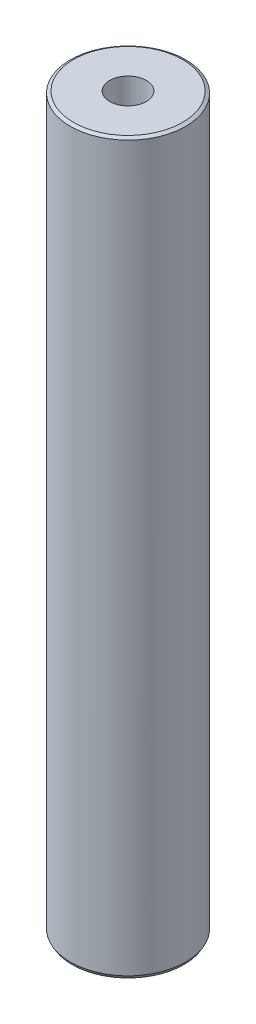
from build123d import *
from OCP.BRepFilletAPI import BRepFilletAPI_MakeChamfer

# Parameters (mm, degrees)
SKETCH1_R           = 47.5
BOSS_EXTRUDE1_DEPTH = 600
SKETCH2_R           = 15.071937105
CUT_EXTRUDE1_DEPTH  = 604.748706003
CHAMFER1_SIZE       = 1.500488561
CHAMFER1_SIZE2      = 2.598922424


with BuildPart() as part:
    # Sketch1 → Boss-Extrude1 (new body)
    with BuildSketch(Plane(origin=(0, 0, 0), x_dir=(1, 0, 0), z_dir=(0, 1, 0))):
        Circle(SKETCH1_R)
    extrude(amount=BOSS_EXTRUDE1_DEPTH)

    # Sketch2 → Cut-Extrude1 (cut, through all)
    with BuildSketch(Plane(origin=(0, 0, 0), x_dir=(1, 0, 0), z_dir=(0, 1, 0))):
        Circle(SKETCH2_R)
    extrude(amount=CUT_EXTRUDE1_DEPTH, mode=Mode.SUBTRACT)

    # Chamfer1: one chamfer whose edges measure the first distance from different faces: ONE call of the kernel's chamfer builder (chamfer() names one face for all edges)
    chamfer1_edges_1 = [part.edges().sort_by_distance(p)[0] for p in [
        (-47.5, 600, 0),
    ]]
    chamfer1_side_1 = [part.faces().sort_by_distance(p)[0] for p in [
        (-47.5, 300, 0),
    ]]
    chamfer1_edges_2 = [part.edges().sort_by_distance(p)[0] for p in [
        (-47.5, 0, 0),
    ]]
    chamfer1_side_2 = [part.faces().sort_by_distance(p)[0] for p in [
        (-46.156497116, 0, 0),
    ]]
    chamfer1 = BRepFilletAPI_MakeChamfer(part.part.solid().wrapped)
    for e in chamfer1_edges_1:
        chamfer1.Add(CHAMFER1_SIZE, CHAMFER1_SIZE2, e.wrapped, chamfer1_side_1[0].wrapped)  # the first distance lies on this face
    for e in chamfer1_edges_2:
        chamfer1.Add(CHAMFER1_SIZE, CHAMFER1_SIZE2, e.wrapped, chamfer1_side_2[0].wrapped)  # the first distance lies on this face
    add(Compound.cast(chamfer1.Shape()), mode=Mode.REPLACE)


solid = part.part
